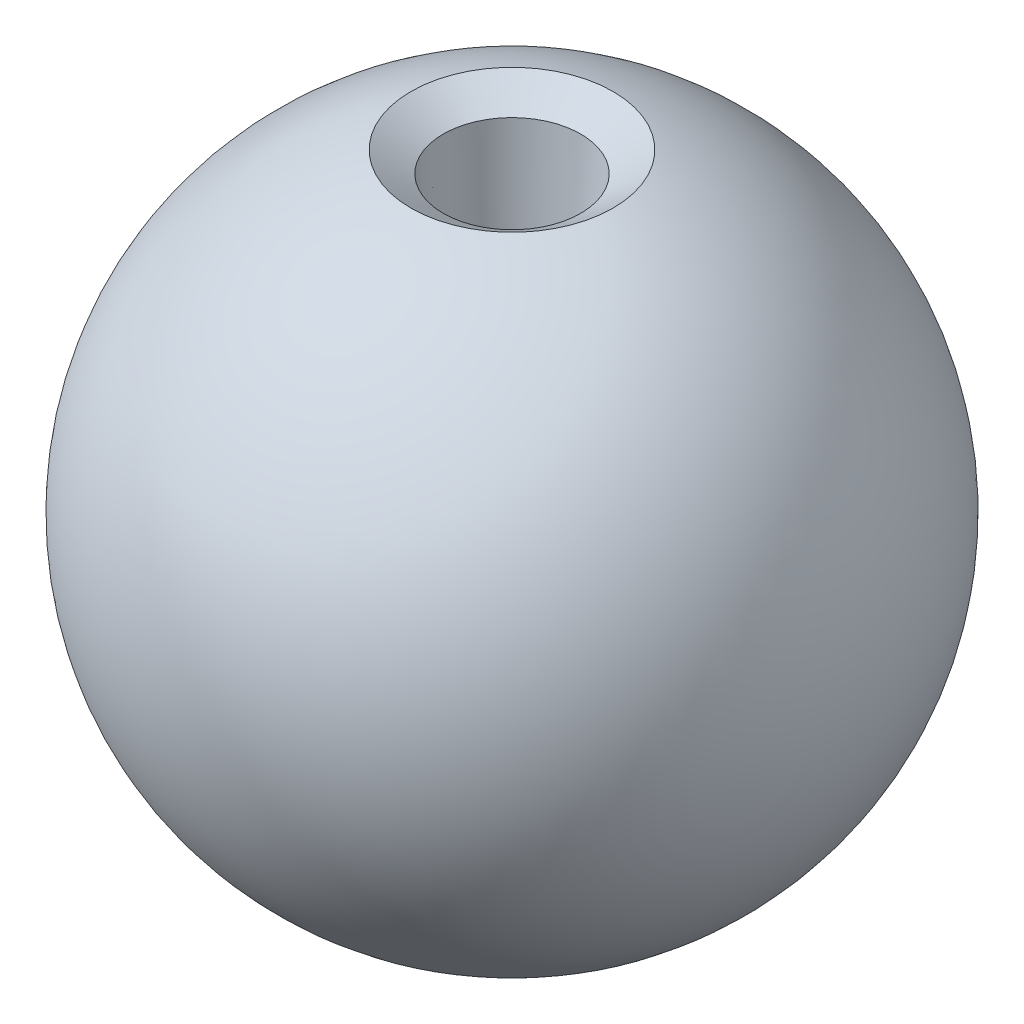
from build123d import *

# Parameters (mm, degrees)
CHAMFER1_SIZE = 0.878417015


with BuildPart() as part:
    # Sketch1 → Revolve1 (revolve)
    with BuildSketch(Plane(origin=(0, 0, 0), x_dir=(0, 0, -1), z_dir=(1, 0, 0))):
        with BuildLine():
            Line((0, 0), (0, 10))
            ThreePointArc((0, 10), (10, 0), (0, -10))
            Line((0, -10), (0, 0))
        make_face()
    revolve(axis=Axis((0, 0, 0), (0, 1, 0)))

    # Sketch2 → Cut-Revolve1 (revolve, cut)
    with BuildSketch(Plane(origin=(0, 0, 0), x_dir=(0, 0, -1), z_dir=(1, 0, 0)), mode=Mode.PRIVATE) as cut_revolve1_sk:
        Polygon((0, 0), (0, 10.64), (2.2, 10.64), (1.5, 0), align=None)
    revolve(cut_revolve1_sk.sketch.rotate(Axis((0, 0, 0), (0, 1, 0)), 180), axis=Axis((0, 0, 0), (0, 1, 0)), mode=Mode.SUBTRACT)

    # Chamfer1
    # the kernel refuses this chamfer: 1, 0.878417015 mm, written as the material it takes off along each edge
    with BuildSketch(Plane(origin=(0, 9.767763137, 0), x_dir=(0, 0, 1), z_dir=(-1, 0, 0))) as chamfer1_piece_1:
        with BuildLine():
            Line((3.065028643, -0.249065777), (2.142615996 - CHAMFER1_SIZE * 0.0656475573893, -CHAMFER1_SIZE * 0.997842872317))
            Line((2.142615996 - CHAMFER1_SIZE * 0.0656475573893, -CHAMFER1_SIZE * 0.997842872317), (2.142615996, 0))
            ThreePointArc((2.142615996, 0), (2.619777215, -0.117023924), (3.065028643, -0.249065777))
        make_face()
    revolve(axis=Axis((0, 9.767763137, 0), (0, 1, 0)), revolution_arc=180, mode=Mode.SUBTRACT)
    with BuildSketch(Plane(origin=(0, 9.767763137, 0), x_dir=(0, 0, -1), z_dir=(1, 0, 0))) as chamfer1_piece_2:
        with BuildLine():
            Line((3.065028643, -0.249065777), (2.142615996 - CHAMFER1_SIZE * 0.0656475573893, -CHAMFER1_SIZE * 0.997842872317))
            Line((2.142615996 - CHAMFER1_SIZE * 0.0656475573893, -CHAMFER1_SIZE * 0.997842872317), (2.142615996, 0))
            ThreePointArc((2.142615996, 0), (2.619777215, -0.117023924), (3.065028643, -0.249065777))
        make_face()
    revolve(axis=Axis((0, 9.767763137, 0), (0, 1, 0)), revolution_arc=180, mode=Mode.SUBTRACT)


solid = part.part
